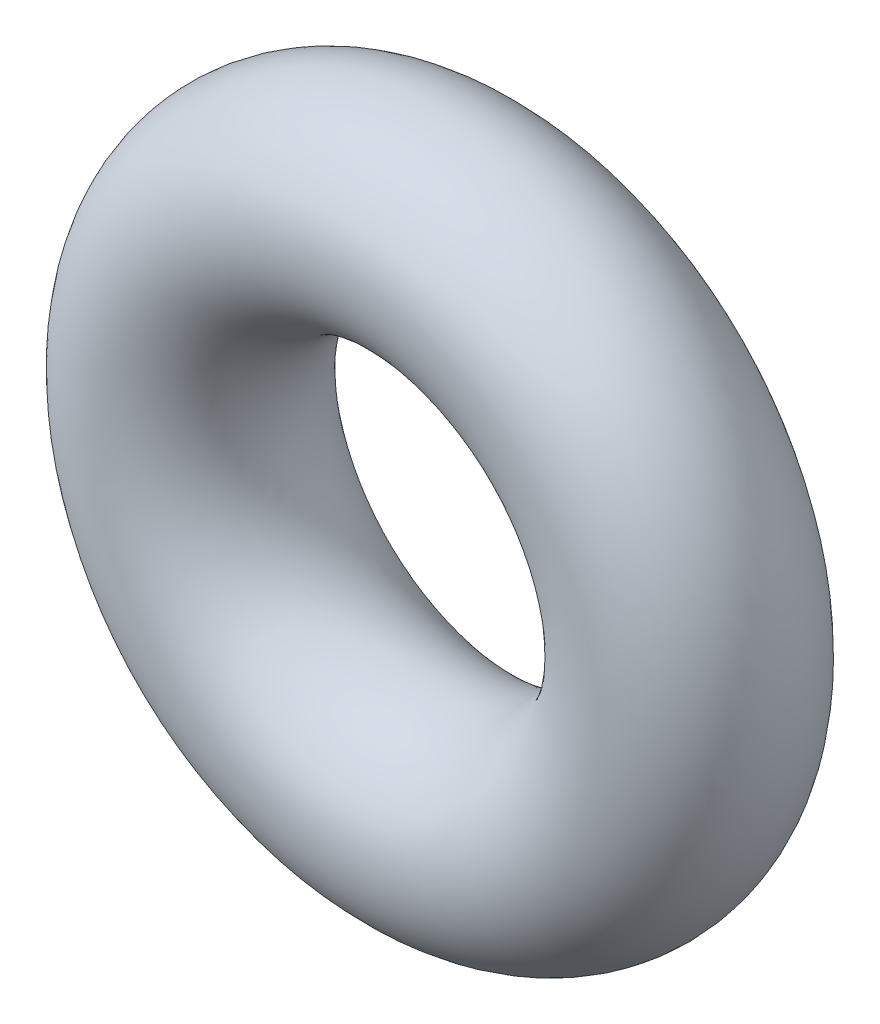
from build123d import *

# Parameters (mm, degrees)
SKETCH1_R = 0.889


with BuildPart() as part:
    # Sketch1 → Revolve1 (revolve)
    with BuildSketch(Plane(origin=(0, 0, 0), x_dir=(0, -1, 0), z_dir=(1, 0, 0))):
        with Locations((2.1717, 0)):
            Circle(SKETCH1_R)
    revolve(axis=Axis((0, 0, 0.889), (0, 0, -1)))


solid = part.part
